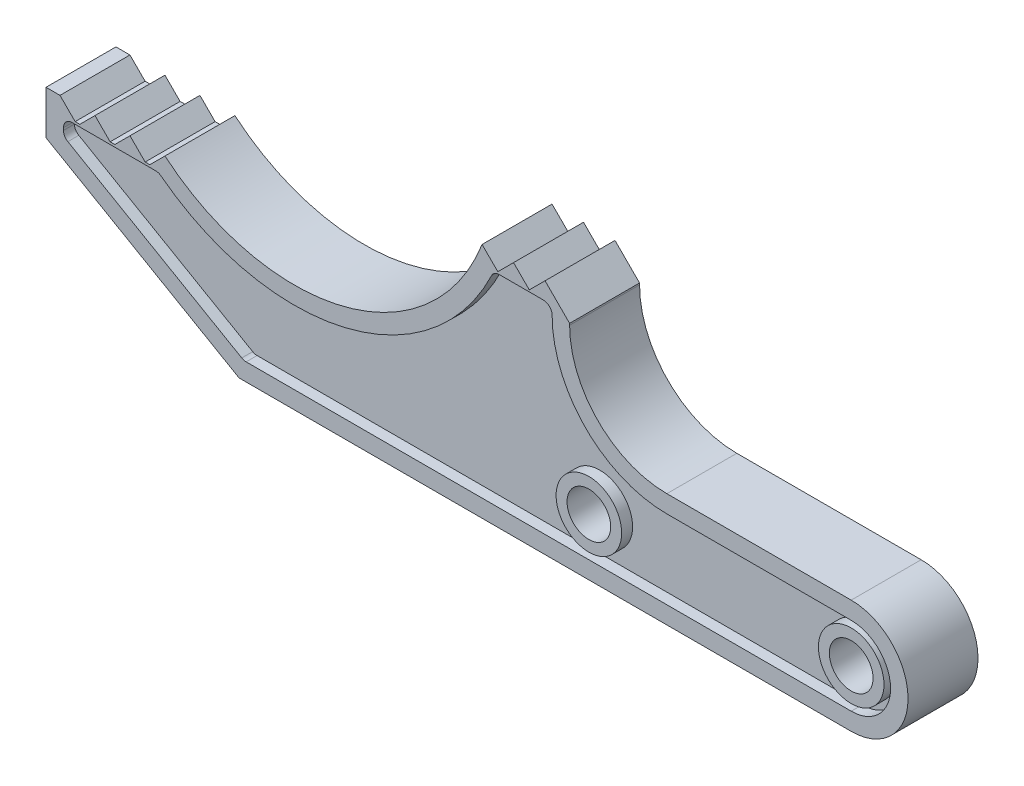
from build123d import *

# Parameters (mm, degrees)
BOSS_EXTRUDE1_DEPTH     = 4
SKETCH2_R               = 2.5
CUT_EXTRUDE1_DEPTH      = 64.702725576
CUT_EXTRUDE2_DEPTH      = 1.25
SKETCH4_R               = 3.75
SKETCH4_R_2             = 2.5
BOSS_EXTRUDE2_DEPTH     = 1.25
CUT_EXTRUDE8_DEPTH      = 64.702725576
CUT_EXTRUDE8_DEPTH_BACK = 64.702725576
CUT_EXTRUDE9_DEPTH      = 64.702725576
CUT_EXTRUDE9_DEPTH_BACK = 64.702725576
FILLET5_R               = 1
FILLET6_R               = 1
FILLET7_R               = 1
FILLET8_R               = 1


with BuildPart() as part:
    # Sketch1 → Boss-Extrude1 (new, symmetric)
    with BuildSketch(Plane.XY):
        with BuildLine():
            Line((-35, 0), (35, 0))
            ThreePointArc((35, 0), (41.5, 6.5), (35, 13))
            Line((35, 13), (13.916352203, 13))
            ThreePointArc((13.916352203, 13), (6.053324797, 16.256972593), (2.796352203, 24.12))
            Line((2.796352203, 24.12), (2.796352203, 27.12))
            Line((2.796352203, 27.12), (-7.213647797, 27.12))
            ThreePointArc((-7.213647797, 27.12), (-22.934441841, 13.089935965), (-43.483647797, 17.75))
            Line((-43.483647797, 17.75), (-57.083647797, 17.75))
            Line((-57.083647797, 17.75), (-57.083647797, 12.75))
            Line((-57.083647797, 12.75), (-35, 0))
        make_face()
    extrude(amount=BOSS_EXTRUDE1_DEPTH, both=True)

    # Sketch2 → Cut-Extrude1 (cut, through all)
    with BuildSketch(Plane(origin=(0, 0, -4), x_dir=(-1, 0, 0), z_dir=(0, 0, -1))):
        with Locations((-35, 6.5)):
            Circle(SKETCH2_R)
        with Locations((-5, 6.5)):
            Circle(SKETCH2_R)
    extrude(amount=-CUT_EXTRUDE1_DEPTH, mode=Mode.SUBTRACT)

    # Sketch3 → Cut-Extrude2 (cut)
    with BuildSketch(Plane.XY.offset(4)):
        with BuildLine():
            Line((-44.195256898, 15.75), (-55.083647797, 15.75))
            Line((-55.083647797, 15.75), (-55.083647797, 13.904700538))
            Line((-55.083647797, 13.904700538), (-34.464101615, 2))
            Line((-34.464101615, 2), (35, 2))
            ThreePointArc((35, 2), (39.5, 6.5), (35, 11))
            Line((35, 11), (13.916352203, 11))
            ThreePointArc((13.916352203, 11), (4.639111234, 14.842759031), (0.796352203, 24.12))
            Line((0.796352203, 24.12), (0.796352203, 25.12))
            Line((0.796352203, 25.12), (-5.880235749, 25.12))
            ThreePointArc((-5.880235749, 25.12), (-22.748609603, 11.074453376), (-44.195256898, 15.75))
        make_face()
    cut_extrude2 = extrude(amount=-CUT_EXTRUDE2_DEPTH, mode=Mode.SUBTRACT)

    # Sketch4 → Boss-Extrude2 (add)
    # profile 1 of 2: a face of its own
    with BuildSketch(Plane.XY.offset(2.75)):
        with Locations((5, 6.5)):
            Circle(SKETCH4_R)
        with Locations(Location((5, 6.5, 0), (0, 0, 180))):
            Circle(SKETCH4_R_2, mode=Mode.SUBTRACT)
    # profile 2 of 2: a face of its own
    with BuildSketch(Plane.XY.offset(2.75)):
        with Locations((35, 6.5)):
            Circle(SKETCH4_R)
        with Locations(Location((35, 6.5, 0), (0, 0, 180))):
            Circle(SKETCH4_R_2, mode=Mode.SUBTRACT)
    boss_extrude2 = extrude(amount=BOSS_EXTRUDE2_DEPTH)

    # Mirror1: Cut-Extrude2, Boss-Extrude2 across plane
    add(cut_extrude2.mirror(Plane.XY), mode=Mode.SUBTRACT)
    add(boss_extrude2.mirror(Plane.XY))

    # Sketch6 → Cut-Extrude8 (cut, two sides: drawn at the far end of the back side and taken through both)
    with BuildSketch(Plane.XY.offset(4).offset(-CUT_EXTRUDE8_DEPTH_BACK)):
        Polygon((-201.988502331, 164.254854535), (-55.483647797, 17.75), (-53.750566679, 16.016918882), (-53.214504533, 16.016918882), (-51.481423415, 17.75), (-49.748342297, 16.016918882), (-49.212280151, 16.016918882), (-47.479199033, 17.75), (-45.746117916, 16.016918882), (-45.21005577, 16.016918882), (-43.476974652, 17.75), (103.027879883, 164.254854535), (103.027879883, 578.633159007), (-201.988502331, 578.633159007), align=None)
    extrude(amount=CUT_EXTRUDE8_DEPTH + CUT_EXTRUDE8_DEPTH_BACK, mode=Mode.SUBTRACT)

    # Sketch9 → Cut-Extrude9 (cut, two sides: drawn at the far end of the back side and taken through both)
    with BuildSketch(Plane.XY.offset(4).offset(-CUT_EXTRUDE9_DEPTH_BACK)):
        Polygon((-3.613647797, 27.12), (-7.213647797, 27.12), (-5.413647797, 25.32), align=None)
        Polygon((-0.013647797, 27.12), (-3.613647797, 27.12), (-1.813647797, 25.32), align=None)
        Polygon((2.796352203, 27.12), (-0.013647797, 27.12), (2.796352203, 24.31), align=None)
    extrude(amount=CUT_EXTRUDE9_DEPTH + CUT_EXTRUDE9_DEPTH_BACK, mode=Mode.SUBTRACT)

    # Fillet5
    fillet5_edges = [part.edges().sort_by_distance(p)[0] for p in [
        (-55.083647797, 15.75, 3.375),
    ]]
    fillet(fillet5_edges, radius=FILLET5_R)

    # Fillet6
    fillet6_edges = [part.edges().sort_by_distance(p)[0] for p in [
        (-44.195256898, 15.75, 3.375),
        (-55.083647797, 13.904700538, 3.375),
    ]]
    fillet(fillet6_edges, radius=FILLET6_R)

    # Fillet7
    fillet7_edges = [part.edges().sort_by_distance(p)[0] for p in [
        (0.796352203, 25.12, 3.375),
        (-34.464101615, 2, 3.375),
        (-5.880235749, 25.12, 3.375),
    ]]
    fillet(fillet7_edges, radius=FILLET7_R - 0.0001)  # a hair under: the kernel refuses the full size

    # Fillet8
    fillet8_edges = [part.edges().sort_by_distance(p)[0] for p in [
        (-55.083647797, 13.904700538, -3.375),
        (-34.464101615, 2, -3.375),
        (-44.195256898, 15.75, -3.375),
        (-55.083647797, 15.75, -3.375),
        (-5.880235749, 25.12, -3.375),
        (0.796352203, 25.12, -3.375),
    ]]
    fillet(fillet8_edges, radius=FILLET8_R - 0.0001)  # a hair under: the kernel refuses the full size


solid = part.part
